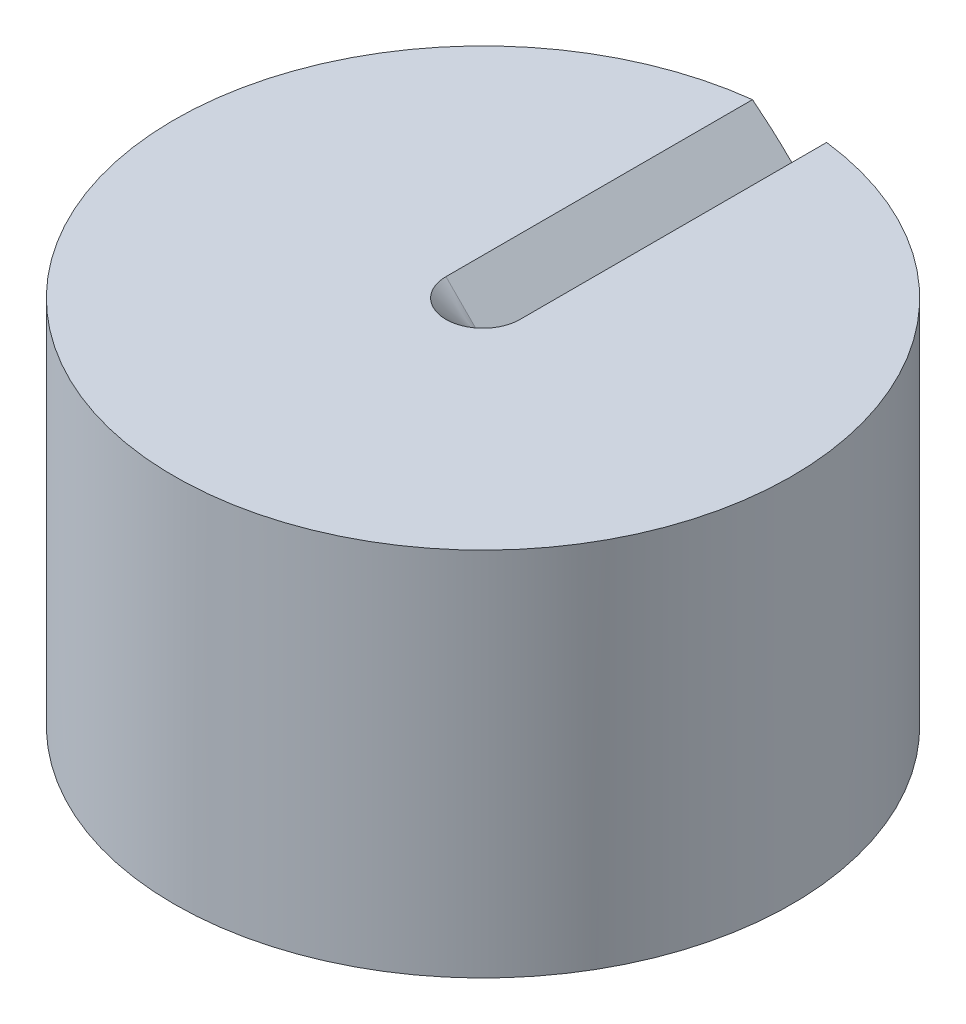
from build123d import *

# Parameters (mm, degrees)
SKETCH1_R           = 19.05
BOSS_EXTRUDE1_DEPTH = 20.32
SKETCH2_R           = 2.9845
CUT_EXTRUDE1_DEPTH  = 6.858
SKETCH3_R           = 16.51
SKETCH3_R_2         = 5.0165
CUT_EXTRUDE2_DEPTH  = 15.24
FILLET1_R           = 2.032
CUT_EXTRUDE3_START  = -2.286
CUT_EXTRUDE3_DEPTH  = 2.286
CHAMFER1_SIZE       = 2.54
BOSS_EXTRUDE2_START = 2.54
SKETCH6_R           = 19.05
SKETCH6_R_2         = 16.51
BOSS_EXTRUDE2_DEPTH = 2.54


with BuildPart() as part:
    # Sketch1 → Boss-Extrude1 (new body)
    with BuildSketch(Plane(origin=(0, 0, 0), x_dir=(1, 0, 0), z_dir=(0, 1, 0))):
        with Locations(Location((0, 0, 0), (0, 0, 270))):
            Circle(SKETCH1_R)
    extrude(amount=BOSS_EXTRUDE1_DEPTH)

    # Sketch2 → Cut-Extrude1 (cut)
    with BuildSketch(Plane(origin=(0, 0, 0), x_dir=(-1, 0, 0), z_dir=(0, -1, 0))):
        with Locations(Location((0, 0, 0), (0, 0, 90))):
            Circle(SKETCH2_R)
    extrude(amount=-CUT_EXTRUDE1_DEPTH, mode=Mode.SUBTRACT)

    # Sketch3 → Cut-Extrude2 (cut)
    with BuildSketch(Plane.XZ):
        with Locations(Location((0, 0, 0), (0, 0, 270))):
            Circle(SKETCH3_R)
        with Locations(Location((0, 0, 0), (0, 0, 270))):
            Circle(SKETCH3_R_2, mode=Mode.SUBTRACT)
    extrude(amount=-CUT_EXTRUDE2_DEPTH, mode=Mode.SUBTRACT)

    # Fillet1
    fillet1_edges = [part.edges().sort_by_distance(p)[0] for p in [
        (0, 15.24, 5.0165),
    ]]
    fillet(fillet1_edges, radius=FILLET1_R)

    # Sketch4 → Cut-Extrude3 (cut)
    with BuildSketch(Plane(origin=(0, 20.32, 0), x_dir=(1, 0, 0), z_dir=(0, 1, 0)).offset(CUT_EXTRUDE3_START)):
        with BuildLine():
            Line((-2.54, 0), (-2.54, 18.879907309))
            ThreePointArc((-2.54, 18.879907309), (0, 19.05), (2.54, 18.879907309))
            Line((2.54, 18.879907309), (2.54, 0))
            ThreePointArc((2.54, 0), (0, -2.54), (-2.54, 0))
        make_face()
    extrude(amount=CUT_EXTRUDE3_DEPTH, mode=Mode.SUBTRACT)

    # Chamfer1
    # the kernel refuses this chamfer: 2.54 mm, written as the material it adds along each edge
    with BuildSketch(Plane(origin=(2.54, 18.034, -25.411982099), x_dir=(-1, 0, 0), z_dir=(0, 0, 1))) as chamfer1_piece_1_section:
        Polygon((CHAMFER1_SIZE, 0), (0, -CHAMFER1_SIZE), (0, 0), align=None)
    chamfer1_piece_1 = extrude(amount=25.411982099, mode=Mode.PRIVATE)
    chamfer1_piece_1 = chamfer1_piece_1 & Plane(origin=(0, 18.034, 0), x_dir=(0, 0, 1), z_dir=(0, -1, 0)) * Cylinder(19.05, 61, mode=Mode.PRIVATE)
    chamfer1_piece_1 = split(chamfer1_piece_1, bisect_by=Plane(origin=(2.54, 20.32, -25.411982099), z_dir=(0, -1, 0)), keep=Keep.TOP, mode=Mode.PRIVATE)
    add(chamfer1_piece_1)
    with BuildSketch(Plane(origin=(0, 18.034, 0), x_dir=(1, 0, 0), z_dir=(0, 0, -1))) as chamfer1_piece_2_section:
        Polygon((2.54 - CHAMFER1_SIZE, 0), (2.54, -CHAMFER1_SIZE), (2.54, 0), align=None)
    chamfer1_piece_2 = revolve(axis=Axis((0, 18.034, 0), (0, -1, 0)), revolution_arc=180, mode=Mode.PRIVATE)
    chamfer1_piece_2 = split(chamfer1_piece_2, bisect_by=Plane(origin=(0, 20.32, 0), z_dir=(0, -1, 0)), keep=Keep.TOP, mode=Mode.PRIVATE)
    add(chamfer1_piece_2)
    with BuildSketch(Plane(origin=(-2.54, 18.034, 0), x_dir=(0, 1, 0), z_dir=(0, 0, -1))) as chamfer1_piece_3_section:
        Polygon((CHAMFER1_SIZE, 0), (0, CHAMFER1_SIZE), (0, 0), align=None)
    chamfer1_piece_3 = extrude(amount=25.411982099, mode=Mode.PRIVATE)
    chamfer1_piece_3 = chamfer1_piece_3 & Plane(origin=(0, 18.034, 0), x_dir=(0, 0, 1), z_dir=(0, -1, 0)) * Cylinder(19.05, 61, mode=Mode.PRIVATE)
    chamfer1_piece_3 = split(chamfer1_piece_3, bisect_by=Plane(origin=(-2.54, 20.32, 0), z_dir=(0, -1, 0)), keep=Keep.TOP, mode=Mode.PRIVATE)
    add(chamfer1_piece_3)

    # Sketch6 → Boss-Extrude2 (add)
    with BuildSketch(Plane.XZ.offset(BOSS_EXTRUDE2_START)):
        with Locations(Location((0, 0, 0), (0, 0, 270))):
            Circle(SKETCH6_R)
        with Locations(Location((0, 0, 0), (0, 0, 270))):
            Circle(SKETCH6_R_2, mode=Mode.SUBTRACT)
    extrude(amount=-BOSS_EXTRUDE2_DEPTH)


solid = part.part
